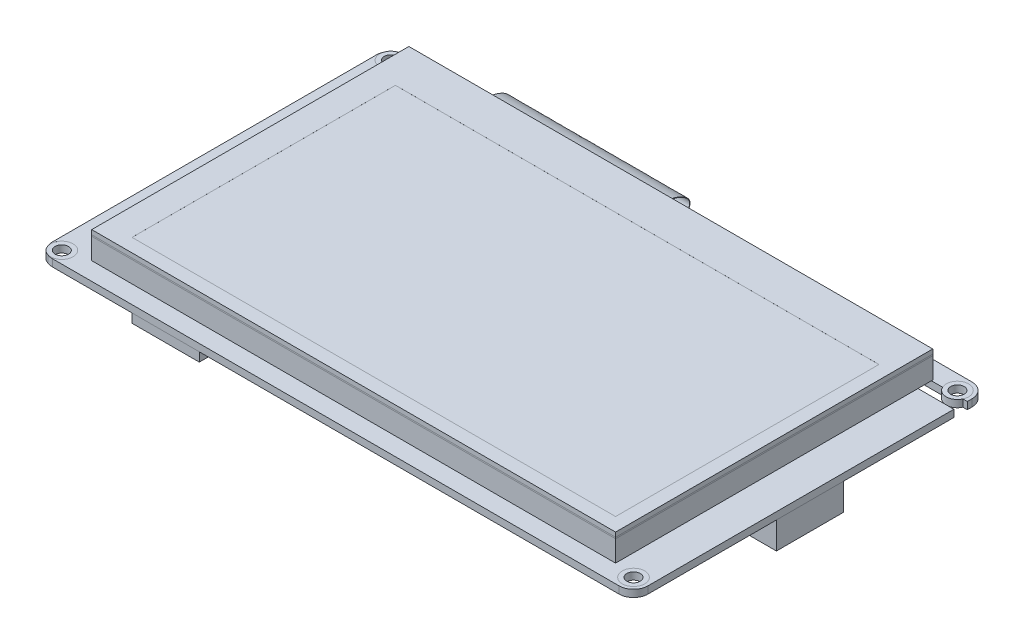
from build123d import *

# Parameters (mm, degrees)
SKETCH1_R                = 1.5
BOSS_EXTRUDE1_DEPTH      = 1.6
SKETCH2_W                = 116.84
SKETCH2_H                = 70.74
BOSS_EXTRUDE2_DEPTH      = 5
SKETCH3_W                = 116.84
SKETCH3_H                = 70.74
BOSS_EXTRUDE3_DEPTH      = 1
SKETCH4_W                = 7.5
SKETCH4_H                = 15
BOSS_EXTRUDE4_DEPTH      = 6
SKETCH5_W                = 15
SKETCH5_H                = 15
BOSS_EXTRUDE5_DEPTH      = 2
SKETCH6_W                = 107.84
SKETCH6_H                = 58.74
CUT_EXTRUDE1_DEPTH       = 0.005
CUT_EXTRUDE14_START      = -10
SKETCH39_R               = 2.5
SKETCH39_R_2             = 1.5
CUT_EXTRUDE14_DEPTH      = 10
SKETCH39_2_R             = 2.5
SKETCH39_2_R_2           = 1.5
BOSS_EXTRUDE18_DEPTH     = 1.6
BOSS_EXTRUDE18_2_DEPTH   = 1.6
BOSS_EXTRUDE18_3_DEPTH   = 1.6
BOSS_EXTRUDE18_4_DEPTH   = 1.6
SKETCH40_W               = 113
SKETCH40_H               = 3
CUT_EXTRUDE15_DEPTH      = 1.6
SPLIT1_SURFACE_1_1_BACK  = 156.021
SPLIT1_SURFACE_1_1_DEPTH = 312.042
SPLIT1_SURFACE_1_2_BACK  = 156.021
SPLIT1_SURFACE_1_2_DEPTH = 312.042
SKETCH43_W               = 20
SKETCH43_H               = 20
BOSS_EXTRUDE19_DEPTH     = 1.25
SKETCH43_3_W             = 10.25
SKETCH43_3_H             = 22.3
BOSS_EXTRUDE20_DEPTH     = 1.15
SKETCH43_5_W             = 6.85
SKETCH43_5_H             = 6.85
BOSS_EXTRUDE21_DEPTH     = 1.7
SKETCH43_6_W             = 5.17
SKETCH43_6_H             = 5.4
BOSS_EXTRUDE22_DEPTH     = 2.2
SKETCH43_7_W             = 4.4
SKETCH43_7_H             = 5.12
BOSS_EXTRUDE23_DEPTH     = 1.1
SKETCH52_W               = 43.5
SKETCH52_H               = 1.6
CUT_EXTRUDE19_DEPTH      = 1
SKETCH54_W               = 43.5
SKETCH54_H               = 1.6
BOSS_EXTRUDE28_DEPTH     = 0.8
SKETCH55_W               = 30.5
SKETCH55_H               = 5.15
BOSS_EXTRUDE29_DEPTH     = 2
EXTRUDE_THIN2_START      = -42.33
EXTRUDE_THIN2_DEPTH      = 40
CUT_EXTRUDE21_DEPTH      = 80.070285044
CUT_EXTRUDE21_DEPTH_BACK = 80.070285044
SKETCH43_9_W             = 7
SKETCH43_9_H             = 5
BOSS_EXTRUDE30_DEPTH     = 2
SKETCH43_10_W            = 6
SKETCH43_10_H            = 3.25
BOSS_EXTRUDE31_DEPTH     = 2.5
SKETCH58_W               = 6
SKETCH58_H               = 6
BOSS_EXTRUDE32_DEPTH     = 4
BOSS_EXTRUDE32_2_DEPTH   = 4


# Read off the part's stored shape, not the designer's step: Extrude-Thin2
with BuildPart() as part:
    # Sketch1 → Boss-Extrude1 (new body)
    with BuildSketch(Plane(origin=(0, 0, 0), x_dir=(1, 0, 0), z_dir=(0, 1, 0))):
        with BuildLine():
            Line((-63.17, 39.37), (63.17, 39.37))
            ThreePointArc((63.17, 39.37), (65.468097039, 38.418097039), (66.42, 36.12))
            Line((66.42, 36.12), (66.42, -36.12))
            ThreePointArc((66.42, -36.12), (65.468097039, -38.418097039), (63.17, -39.37))
            Line((63.17, -39.37), (-63.17, -39.37))
            ThreePointArc((-63.17, -39.37), (-65.468097039, -38.418097039), (-66.42, -36.12))
            Line((-66.42, -36.12), (-66.42, 36.12))
            ThreePointArc((-66.42, 36.12), (-65.468097039, 38.418097039), (-63.17, 39.37))
        make_face()
        with Locations(Location((-63.75, 36.7, 0), (0, 0, 270))):
            Circle(SKETCH1_R, mode=Mode.SUBTRACT)
        with Locations(Location((-63.75, -36.7, 0), (0, 0, 270))):
            Circle(SKETCH1_R, mode=Mode.SUBTRACT)
        with Locations(Location((63.17, -36.12, 0), (0, 0, 270))):
            Circle(SKETCH1_R, mode=Mode.SUBTRACT)
        with Locations(Location((63.17, 36.12, 0), (0, 0, 270))):
            Circle(SKETCH1_R, mode=Mode.SUBTRACT)
    extrude(amount=BOSS_EXTRUDE1_DEPTH)

    # Sketch39 → Cut-Extrude14 (cut)
    # profile 1 of 4: a face of its own
    with BuildSketch(Plane(origin=(0, 1.6, 0), x_dir=(1, 0, 0), z_dir=(0, 1, 0)).offset(CUT_EXTRUDE14_START)):
        with Locations(Location((63.17, -36.12, 0), (0, 0, 270))):
            Circle(SKETCH39_R)
        with Locations((63.17, -36.12)):
            Circle(SKETCH39_R_2, mode=Mode.SUBTRACT)
    # profile 2 of 4: a face of its own
    with BuildSketch(Plane(origin=(0, 1.6, 0), x_dir=(1, 0, 0), z_dir=(0, 1, 0)).offset(CUT_EXTRUDE14_START)):
        with Locations((-63.75, -36.7)):
            Circle(SKETCH39_R)
        with Locations((-63.75, -36.7)):
            Circle(SKETCH39_R_2, mode=Mode.SUBTRACT)
    # profile 3 of 4: a face of its own
    with BuildSketch(Plane(origin=(0, 1.6, 0), x_dir=(1, 0, 0), z_dir=(0, 1, 0)).offset(CUT_EXTRUDE14_START)):
        with Locations(Location((63.17, 36.12, 0), (0, 0, 270))):
            Circle(SKETCH39_R)
        with Locations((63.17, 36.12)):
            Circle(SKETCH39_R_2, mode=Mode.SUBTRACT)
    # profile 4 of 4: a face of its own
    with BuildSketch(Plane(origin=(0, 1.6, 0), x_dir=(1, 0, 0), z_dir=(0, 1, 0)).offset(CUT_EXTRUDE14_START)):
        with Locations((-63.75, 36.7)):
            Circle(SKETCH39_R)
        with Locations((-63.75, 36.7)):
            Circle(SKETCH39_R_2, mode=Mode.SUBTRACT)
    extrude(amount=CUT_EXTRUDE14_DEPTH, mode=Mode.SUBTRACT)

    # Sketch40 → Cut-Extrude15 (cut)
    with BuildSketch(Plane.XZ):
        with Locations((18.58, -33.57)):
            Rectangle(SKETCH40_W, SKETCH40_H)
    extrude(amount=-CUT_EXTRUDE15_DEPTH, mode=Mode.SUBTRACT)


with BuildPart() as body_2:
    # Sketch2 → Boss-Extrude2 (new body)
    with BuildSketch(Plane(origin=(0, 1.6, 0), x_dir=(1, 0, 0), z_dir=(0, 1, 0))):
        Rectangle(SKETCH2_W, SKETCH2_H)
    extrude(amount=BOSS_EXTRUDE2_DEPTH)


with BuildPart() as body_3:
    # Sketch3 → Boss-Extrude3 (new body)
    with BuildSketch(Plane(origin=(0, 6.6, 0), x_dir=(1, 0, 0), z_dir=(0, 1, 0))):
        Rectangle(SKETCH3_W, SKETCH3_H)
    extrude(amount=BOSS_EXTRUDE3_DEPTH)

    # Sketch6 → Cut-Extrude1 (cut)
    with BuildSketch(Plane(origin=(0, 7.6, 0), x_dir=(1, 0, 0), z_dir=(0, 1, 0))):
        with Locations((1.5, -3)):
            Rectangle(SKETCH6_W, SKETCH6_H)
    extrude(amount=-CUT_EXTRUDE1_DEPTH, mode=Mode.SUBTRACT)


with BuildPart() as body_4:
    # Sketch4 → Boss-Extrude4 (new body)
    with BuildSketch(Plane.XZ):
        with Locations((62.67, 0)):
            Rectangle(SKETCH4_W, SKETCH4_H)
    extrude(amount=BOSS_EXTRUDE4_DEPTH)


with BuildPart() as body_5:
    # Sketch5 → Boss-Extrude5 (new body)
    with BuildSketch(Plane.XZ):
        with Locations((-37.92, 31.87)):
            Rectangle(SKETCH5_W, SKETCH5_H)
    extrude(amount=BOSS_EXTRUDE5_DEPTH)


with BuildPart() as body_6:
    # Sketch39<2> → Boss-Extrude18 (new body)
    with BuildSketch(Plane(origin=(0, 1.6, 0), x_dir=(1, 0, 0), z_dir=(0, 1, 0))):
        with Locations(Location((63.17, -36.12, 0), (0, 0, 270))):
            Circle(SKETCH39_2_R)
        with Locations(Location((63.17, -36.12, 0), (0, 0, 270))):
            Circle(SKETCH39_2_R_2, mode=Mode.SUBTRACT)
    extrude(amount=-BOSS_EXTRUDE18_DEPTH)


with BuildPart() as body_7:
    # Sketch39<2> → Boss-Extrude18 2 (new body)
    with BuildSketch(Plane(origin=(0, 1.6, 0), x_dir=(1, 0, 0), z_dir=(0, 1, 0))):
        with Locations(Location((-63.75, -36.7, 0), (0, 0, 270))):
            Circle(SKETCH39_2_R)
        with Locations(Location((-63.75, -36.7, 0), (0, 0, 270))):
            Circle(SKETCH39_2_R_2, mode=Mode.SUBTRACT)
    extrude(amount=-BOSS_EXTRUDE18_2_DEPTH)


with BuildPart() as body_8:
    # Sketch39<2> → Boss-Extrude18 3 (new body)
    with BuildSketch(Plane(origin=(0, 1.6, 0), x_dir=(1, 0, 0), z_dir=(0, 1, 0))):
        with Locations(Location((63.17, 36.12, 0), (0, 0, 270))):
            Circle(SKETCH39_2_R)
        with Locations(Location((63.17, 36.12, 0), (0, 0, 270))):
            Circle(SKETCH39_2_R_2, mode=Mode.SUBTRACT)
    extrude(amount=-BOSS_EXTRUDE18_3_DEPTH)


with BuildPart() as body_9:
    # Sketch39<2> → Boss-Extrude18 4 (new body)
    with BuildSketch(Plane(origin=(0, 1.6, 0), x_dir=(1, 0, 0), z_dir=(0, 1, 0))):
        with Locations(Location((-63.75, 36.7, 0), (0, 0, 270))):
            Circle(SKETCH39_2_R)
        with Locations(Location((-63.75, 36.7, 0), (0, 0, 270))):
            Circle(SKETCH39_2_R_2, mode=Mode.SUBTRACT)
    extrude(amount=-BOSS_EXTRUDE18_4_DEPTH)


with BuildPart() as body_10:
    # Split1: the piece behind the surface
    add(body_2.part)
    # Split1 surface 1: a surface, the sketch's curves swept straight by 312.042 mm
    with BuildLine(Plane.XY.offset(-SPLIT1_SURFACE_1_1_BACK), mode=Mode.PRIVATE) as split1_surface_1_1_path:
        Line((58.42, 6.3), (-58.42, 6.3))
    split1_surface_1_1 = Shell.extrude(split1_surface_1_1_path.wire(), (0 * SPLIT1_SURFACE_1_1_DEPTH, 0 * SPLIT1_SURFACE_1_1_DEPTH, 1 * SPLIT1_SURFACE_1_1_DEPTH))
    split(bisect_by=split1_surface_1_1, keep=Keep.BOTTOM)


with BuildPart() as body_2_1:
    add(body_2.part)

    # Split1: split by a surface, the side it looks to stays
    # Split1 surface 1: a surface, the sketch's curves swept straight by 312.042 mm
    with BuildLine(Plane.XY.offset(-SPLIT1_SURFACE_1_2_BACK), mode=Mode.PRIVATE) as split1_surface_1_2_path:
        Line((58.42, 6.3), (-58.42, 6.3))
    split1_surface_1_2 = Shell.extrude(split1_surface_1_2_path.wire(), (0 * SPLIT1_SURFACE_1_2_DEPTH, 0 * SPLIT1_SURFACE_1_2_DEPTH, 1 * SPLIT1_SURFACE_1_2_DEPTH))
    split(bisect_by=split1_surface_1_2, keep=Keep.TOP)

    # Sketch52 → Cut-Extrude19 (cut)
    with BuildSketch(Plane(origin=(0, 0, -35.37), x_dir=(-1, 0, 0), z_dir=(0, 0, -1))):
        with Locations((22.33, 4.9)):
            Rectangle(SKETCH52_W, SKETCH52_H)
    extrude(amount=-CUT_EXTRUDE19_DEPTH, mode=Mode.SUBTRACT)


with BuildPart() as body_11_2:
    # Sketch43 → Boss-Extrude19 (new body)
    with BuildSketch(Plane.XZ):
        with Locations((-39.58, 10.37)):
            Rectangle(SKETCH43_W, SKETCH43_H)
    extrude(amount=BOSS_EXTRUDE19_DEPTH)


with BuildPart() as body_12:
    # Sketch43<3> → Boss-Extrude20 (new body)
    with BuildSketch(Plane.XZ):
        with Locations((-2.455, 10.22)):
            Rectangle(SKETCH43_3_W, SKETCH43_3_H)
    extrude(amount=BOSS_EXTRUDE20_DEPTH)


with BuildPart() as body_13:
    # Sketch43<5> → Boss-Extrude21 (new body)
    with BuildSketch(Plane.XZ):
        with Locations((-31.995, -6.055)):
            Rectangle(SKETCH43_5_W, SKETCH43_5_H)
    extrude(amount=BOSS_EXTRUDE21_DEPTH)


with BuildPart() as body_14:
    # Sketch43<6> → Boss-Extrude22 (new body)
    with BuildSketch(Plane.XZ):
        with Locations((-48.835, 13.67)):
            Rectangle(SKETCH43_6_W, SKETCH43_6_H)
    extrude(amount=BOSS_EXTRUDE22_DEPTH)


with BuildPart() as body_15:
    # Sketch43<7> → Boss-Extrude23 (new body)
    with BuildSketch(Plane.XZ):
        with Locations((-50.22, -24.69)):
            Rectangle(SKETCH43_7_W, SKETCH43_7_H)
    extrude(amount=BOSS_EXTRUDE23_DEPTH)


with BuildPart() as body_16:
    # Sketch54 → Boss-Extrude28 (new body)
    with BuildSketch(Plane(origin=(0, 0, -34.37), x_dir=(-1, 0, 0), z_dir=(0, 0, -1))):
        with Locations((22.33, 4.9)):
            Rectangle(SKETCH54_W, SKETCH54_H)
    extrude(amount=BOSS_EXTRUDE28_DEPTH)


with BuildPart() as body_17:
    # Sketch55 → Boss-Extrude29 (new body)
    with BuildSketch(Plane.XZ):
        with Locations((0, 2.355)):
            Rectangle(SKETCH55_W, SKETCH55_H)
    extrude(amount=BOSS_EXTRUDE29_DEPTH)


with BuildPart() as body_18:
    # Extrude-Thin2 outline → Extrude-Thin2 (new body)
    with BuildSketch(Plane(origin=(0, 0, 0), x_dir=(0, 0, -1), z_dir=(1, 0, 0)).offset(EXTRUDE_THIN2_START)):
        with BuildLine():
            Line((35.17, 5.261290846), (35.17, 5.161290846))
            add(Edge.make_bspline(
                [(35.17, 5.161290846), (35.626651814, 5.161290846), (36.178826319, 5.150606221), (37.088961556, 5.054864485), (37.405950632, 5.009669361), (38.056744399, 4.882169028), (38.391485376, 4.799245446), (39.386793624, 4.495952989), (40.037841142, 4.221056316), (41.109889237, 3.550895619), (41.528729594, 3.155598196), (41.84237371, 2.504232708), (41.89557611, 2.27801708), (41.880476896, 1.799797607), (41.812042886, 1.544233097), (41.464554394, 0.775988086), (41.043439085, 0.263843837), (40.453227691, -0.221080419), (40.33214952, -0.310285856), (40.087923435, -0.469979739), (39.964374463, -0.54084782), (39.586719752, -0.73009498), (39.325551535, -0.825182517), (38.492323962, -1.043543208), (37.864404223, -1.1), (37.349096065, -1.1)],
                knots=[0, 0, 0, 0, 0.125, 0.125, 0.1875, 0.1875, 0.25, 0.25, 0.375, 0.375, 0.5, 0.5, 0.5625, 0.5625, 0.625, 0.625, 0.75, 0.75, 0.78125, 0.78125, 0.8125, 0.8125, 0.875, 0.875, 1, 1, 1, 1], degree=3))
            Line((37.349096065, -1.1), (0.22, -1.1))
            Line((0.22, -1.1), (0.219999995, -1.2))
            Line((0.219999995, -1.2), (37.349096065, -1.2))
            add(Edge.make_bspline(
                [(35.17, 5.261290846), (35.881750528, 5.261290846), (38.615102871, 5.186858466), (43.317587332, 2.927570212), (40.814022251, -0.333951619), (38.987963428, -1.101147323), (37.858836202, -1.2), (37.349096065, -1.2)],
                knots=[0, 0, 0, 0, 0.194166953, 0.560069396, 0.776613346, 0.878062525, 1, 1, 1, 1], degree=3))
        make_face()
    extrude(amount=EXTRUDE_THIN2_DEPTH)

    # Sketch57 → Cut-Extrude21 (cut, two sides: drawn at the far end of the back side and taken through both)
    with BuildSketch(Plane.XZ.offset(1.2).offset(-CUT_EXTRUDE21_DEPTH_BACK)):
        Polygon((-2.33, -16.22), (12.5, -9.22), (12.5, -0.22), (-2.33, -0.22), align=None)
        Polygon((-12.5, -0.22), (-12.5, -20.22), (-42.33, -33.22), (-42.33, -0.22), align=None)
    extrude(amount=CUT_EXTRUDE21_DEPTH + CUT_EXTRUDE21_DEPTH_BACK, mode=Mode.SUBTRACT)


with BuildPart() as body_19:
    # Sketch43<9> → Boss-Extrude30 (new body)
    with BuildSketch(Plane.XZ):
        with Locations((6.58, 29.37)):
            Rectangle(SKETCH43_9_W, SKETCH43_9_H)
    extrude(amount=BOSS_EXTRUDE30_DEPTH)


with BuildPart() as body_20:
    # Sketch43<10> → Boss-Extrude31 (new body)
    with BuildSketch(Plane.XZ):
        with Locations((-23.42, 32.745)):
            Rectangle(SKETCH43_10_W, SKETCH43_10_H)
    extrude(amount=BOSS_EXTRUDE31_DEPTH)


with BuildPart() as body_21:
    # Sketch58 → Boss-Extrude32 (new body)
    with BuildSketch(Plane.XZ):
        with Locations((35.42, 13.37)):
            Rectangle(SKETCH58_W, SKETCH58_H)
    extrude(amount=BOSS_EXTRUDE32_DEPTH)


with BuildPart() as body_22:
    # Sketch58 → Boss-Extrude32 2 (new body)
    with BuildSketch(Plane.XZ):
        with Locations((23.42, 6.63)):
            Rectangle(SKETCH58_W, SKETCH58_H)
    extrude(amount=BOSS_EXTRUDE32_2_DEPTH)


solid = Compound([part.part, body_3.part, body_4.part, body_5.part, body_6.part, body_7.part, body_8.part, body_9.part, body_10.part, body_2_1.part, body_11_2.part, body_12.part, body_13.part, body_14.part, body_15.part, body_16.part, body_17.part, body_18.part, body_19.part, body_20.part, body_21.part, body_22.part])
